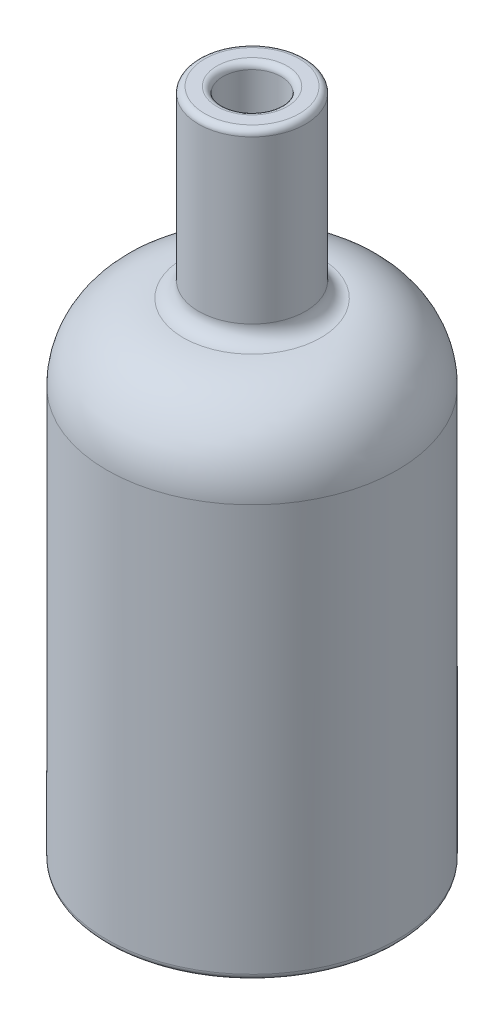
from build123d import *

# Parameters (mm, degrees)
FILLET1_R = 25
FILLET2_R = 5
FILLET3_R = 2
FILLET4_R = 2
FILLET5_R = 17
FILLET6_R = 2
FILLET7_R = 2


with BuildPart() as part:
    # Sketch2 → Revolve1 (revolve)
    with BuildSketch(Plane.XY, mode=Mode.PRIVATE) as revolve1_sk:
        Polygon((0, 0), (47.5, 0), (47.5, 160), (17.5, 160), (17.5, 220), (9.5, 220), (9.5, 152), (39.5, 152), (39.5, 8), (0, 8), align=None)
    revolve(revolve1_sk.sketch.rotate(Axis((0, 0, 0), (0, 1, 0)), 90), axis=Axis((0, 0, 0), (0, 1, 0)))

    # Fillet1
    fillet1_edges = [part.edges().sort_by_distance(p)[0] for p in [
        (0, 160, 47.5),
    ]]
    fillet(fillet1_edges, radius=FILLET1_R)

    # Fillet2
    fillet2_edges = [part.edges().sort_by_distance(p)[0] for p in [
        (0, 160, 17.5),
    ]]
    fillet(fillet2_edges, radius=FILLET2_R - 0.0001)  # a hair under: the kernel refuses the full size

    # Fillet3
    fillet3_edges = [part.edges().sort_by_distance(p)[0] for p in [
        (0, 220, 17.5),
    ]]
    fillet(fillet3_edges, radius=FILLET3_R)

    # Fillet4
    fillet4_edges = [part.edges().sort_by_distance(p)[0] for p in [
        (0, 0, 47.5),
    ]]
    fillet(fillet4_edges, radius=FILLET4_R)

    # Fillet5
    fillet5_edges = [part.edges().sort_by_distance(p)[0] for p in [
        (0, 152, 39.5),
    ]]
    fillet(fillet5_edges, radius=FILLET5_R)

    # Fillet6
    fillet6_edges = [part.edges().sort_by_distance(p)[0] for p in [
        (0, 8, 39.5),
    ]]
    fillet(fillet6_edges, radius=FILLET6_R)

    # Fillet7
    fillet7_edges = [part.edges().sort_by_distance(p)[0] for p in [
        (0, 220, 9.5),
    ]]
    fillet(fillet7_edges, radius=FILLET7_R)


solid = part.part
